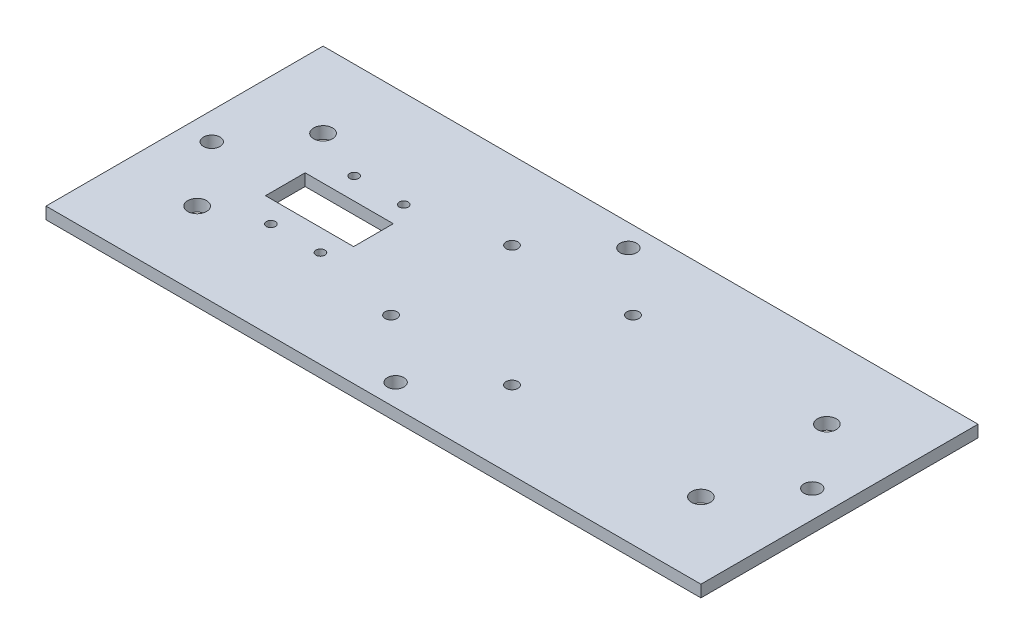
from build123d import *

# Parameters (mm, degrees)
SKETCH1_W           = 165.1
SKETCH1_H           = 69.85
BOSS_EXTRUDE1_DEPTH = 3
CUT_EXTRUDE1_REACH  = 91.684
SKETCH6_R           = 1.5
SKETCH6_W           = 22.225
SKETCH6_H           = 10
CUT_EXTRUDE3_REACH  = 91.684
SKETCH8_R           = 2.38125
SKETCH9_R           = 2.0828
CUT_EXTRUDE5_DEPTH  = 5.08
SKETCH10_R          = 2.0828
CUT_EXTRUDE6_DEPTH  = 5.08
SKETCH11_R          = 1.125
SKETCH11_R_2        = 1.125000036
CUT_EXTRUDE7_DEPTH  = 41.91


with BuildPart() as part:
    # Sketch1 → Boss-Extrude1 (new body)
    with BuildSketch(Plane(origin=(0, 0, 0), x_dir=(1, 0, 0), z_dir=(0, 1, 0))):
        Rectangle(SKETCH1_W, SKETCH1_H)
    extrude(amount=BOSS_EXTRUDE1_DEPTH)

    # Sketch6 → Cut-Extrude1 (cut, up to next)
    with BuildSketch(Plane.XZ, mode=Mode.PRIVATE) as cut_extrude1_sk1:
        with Locations((-15.25, 15.25)):
            Circle(SKETCH6_R)
    cut_extrude1_tool1 = extrude(cut_extrude1_sk1.sketch, amount=-CUT_EXTRUDE1_REACH, mode=Mode.PRIVATE) & part.part
    # Sketch6 → Cut-Extrude1 (cut, up to next)
    with BuildSketch(Plane.XZ, mode=Mode.PRIVATE) as cut_extrude1_sk2:
        with Locations((15.25, 15.25)):
            Circle(SKETCH6_R)
    cut_extrude1_tool2 = extrude(cut_extrude1_sk2.sketch, amount=-CUT_EXTRUDE1_REACH, mode=Mode.PRIVATE) & part.part
    # Sketch6 → Cut-Extrude1 (cut, up to next)
    with BuildSketch(Plane.XZ, mode=Mode.PRIVATE) as cut_extrude1_sk3:
        with Locations((-15.25, -15.25)):
            Circle(SKETCH6_R)
    cut_extrude1_tool3 = extrude(cut_extrude1_sk3.sketch, amount=-CUT_EXTRUDE1_REACH, mode=Mode.PRIVATE) & part.part
    # Sketch6 → Cut-Extrude1 (cut, up to next)
    with BuildSketch(Plane.XZ, mode=Mode.PRIVATE) as cut_extrude1_sk4:
        with Locations((15.25, -15.25)):
            Circle(SKETCH6_R)
    cut_extrude1_tool4 = extrude(cut_extrude1_sk4.sketch, amount=-CUT_EXTRUDE1_REACH, mode=Mode.PRIVATE) & part.part
    # Sketch6 → Cut-Extrude1 (cut, up to next)
    with BuildSketch(Plane.XZ, mode=Mode.PRIVATE) as cut_extrude1_sk5:
        with Locations((-46.0375, 0)):
            Rectangle(SKETCH6_W, SKETCH6_H)
    cut_extrude1_tool5 = extrude(cut_extrude1_sk5.sketch, amount=-CUT_EXTRUDE1_REACH, mode=Mode.PRIVATE) & part.part
    add(cut_extrude1_tool1.solids().sort_by_distance((-15.25, 0, 15.25))[0], mode=Mode.SUBTRACT)
    add(cut_extrude1_tool2.solids().sort_by_distance((15.25, 0, 15.25))[0], mode=Mode.SUBTRACT)
    add(cut_extrude1_tool3.solids().sort_by_distance((-15.25, 0, -15.25))[0], mode=Mode.SUBTRACT)
    add(cut_extrude1_tool4.solids().sort_by_distance((15.25, 0, -15.25))[0], mode=Mode.SUBTRACT)
    add(cut_extrude1_tool5.solids().sort_by_distance((-46.0375, 0, 0))[0], mode=Mode.SUBTRACT)

    # Sketch8 → Cut-Extrude3 (cut, up to next)
    with BuildSketch(Plane(origin=(0, 3, 0), x_dir=(1, 0, 0), z_dir=(0, 1, 0)), mode=Mode.PRIVATE) as cut_extrude3_sk1:
        with Locations((-63.5, -15.875)):
            Circle(SKETCH8_R)
    cut_extrude3_tool1 = extrude(cut_extrude3_sk1.sketch, amount=-CUT_EXTRUDE3_REACH, mode=Mode.PRIVATE) & part.part
    # Sketch8 → Cut-Extrude3 (cut, up to next)
    with BuildSketch(Plane(origin=(0, 3, 0), x_dir=(1, 0, 0), z_dir=(0, 1, 0)), mode=Mode.PRIVATE) as cut_extrude3_sk2:
        with Locations((-63.5, 15.875)):
            Circle(SKETCH8_R)
    cut_extrude3_tool2 = extrude(cut_extrude3_sk2.sketch, amount=-CUT_EXTRUDE3_REACH, mode=Mode.PRIVATE) & part.part
    # Sketch8 → Cut-Extrude3 (cut, up to next)
    with BuildSketch(Plane(origin=(0, 3, 0), x_dir=(1, 0, 0), z_dir=(0, 1, 0)), mode=Mode.PRIVATE) as cut_extrude3_sk3:
        with Locations((63.5, 15.875)):
            Circle(SKETCH8_R)
    cut_extrude3_tool3 = extrude(cut_extrude3_sk3.sketch, amount=-CUT_EXTRUDE3_REACH, mode=Mode.PRIVATE) & part.part
    # Sketch8 → Cut-Extrude3 (cut, up to next)
    with BuildSketch(Plane(origin=(0, 3, 0), x_dir=(1, 0, 0), z_dir=(0, 1, 0)), mode=Mode.PRIVATE) as cut_extrude3_sk4:
        with Locations((63.5, -15.875)):
            Circle(SKETCH8_R)
    cut_extrude3_tool4 = extrude(cut_extrude3_sk4.sketch, amount=-CUT_EXTRUDE3_REACH, mode=Mode.PRIVATE) & part.part
    add(cut_extrude3_tool1.solids().sort_by_distance((-63.5, 3, 15.875))[0], mode=Mode.SUBTRACT)
    add(cut_extrude3_tool2.solids().sort_by_distance((-63.5, 3, -15.875))[0], mode=Mode.SUBTRACT)
    add(cut_extrude3_tool3.solids().sort_by_distance((63.5, 3, -15.875))[0], mode=Mode.SUBTRACT)
    add(cut_extrude3_tool4.solids().sort_by_distance((63.5, 3, 15.875))[0], mode=Mode.SUBTRACT)

    # Sketch9 → Cut-Extrude5 (cut)
    with BuildSketch(Plane(origin=(0, 3, 0), x_dir=(1, 0, 0), z_dir=(0, 1, 0))):
        with Locations((-75.692, 0)):
            Circle(SKETCH9_R)
        with Locations((75.692, 0)):
            Circle(SKETCH9_R)
    extrude(amount=-CUT_EXTRUDE5_DEPTH, mode=Mode.SUBTRACT)

    # Sketch10 → Cut-Extrude6 (cut)
    with BuildSketch(Plane(origin=(0, 3, 0), x_dir=(1, 0, 0), z_dir=(0, 1, 0))):
        with Locations((0, -29.337)):
            Circle(SKETCH10_R)
        with Locations((0, 29.337)):
            Circle(SKETCH10_R)
    extrude(amount=-CUT_EXTRUDE6_DEPTH, mode=Mode.SUBTRACT)

    # Sketch11 → Cut-Extrude7 (cut)
    with BuildSketch(Plane(origin=(0, 3, 0), x_dir=(1, 0, 0), z_dir=(0, 1, 0))):
        with Locations((-50.2875, 10.5)):
            Circle(SKETCH11_R)
        with Locations((-37.7875, 10.5)):
            Circle(SKETCH11_R_2)
        with Locations((-37.7875, -10.5)):
            Circle(SKETCH11_R_2)
        with Locations((-50.2875, -10.5)):
            Circle(SKETCH11_R_2)
    extrude(amount=-CUT_EXTRUDE7_DEPTH, mode=Mode.SUBTRACT)


solid = part.part
